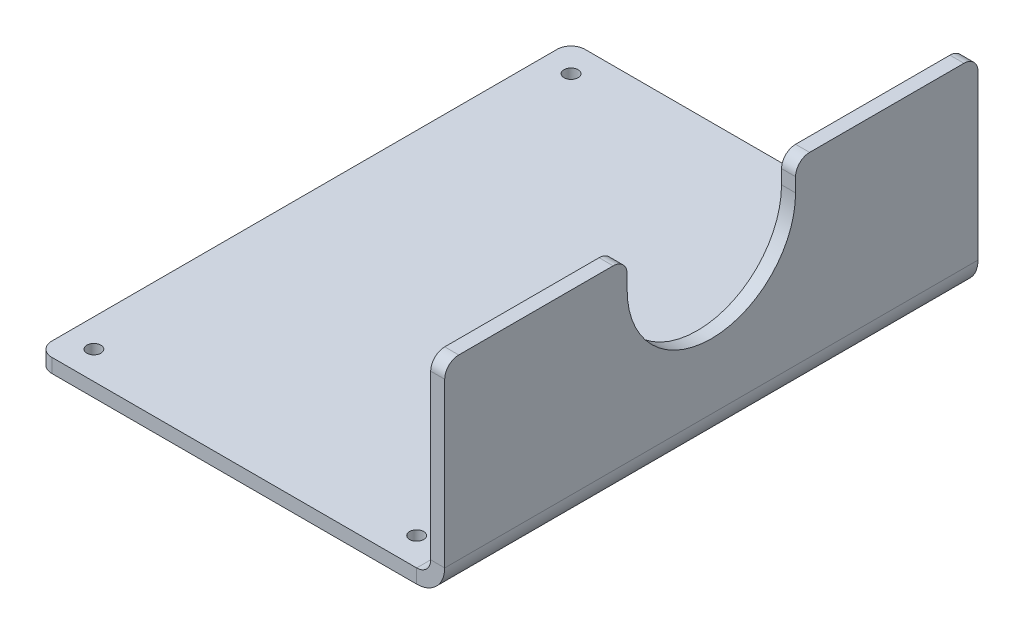
from build123d import *

# Parameters (mm, degrees)
SKETCH1_W              = 133.35
SKETCH1_H              = 120.65
BOSS_EXTRUDE1_DEPTH    = 3.175
SKETCHED_START         = -120.65
SKETCHED_BEND1_DEPTH   = 120.65
SKETCHED_BEND1_2_DEPTH = 120.65
CUT_EXTRUDE1_DEPTH     = 157.911861269
SKETCH9_R              = 1.5875
CUT_EXTRUDE2_DEPTH     = 158.831464015
FILLET1_R              = 3.175


# Read off the part's stored shape, not the designer's step: Sketched Bend1
with BuildPart() as part:
    # Sketch1 → Boss-Extrude1 (new body)
    with BuildSketch(Plane(origin=(0, 0, 0), x_dir=(1, 0, 0), z_dir=(0, 1, 0))):
        with Locations((66.675, 60.325)):
            Rectangle(SKETCH1_W, SKETCH1_H)
    extrude(amount=BOSS_EXTRUDE1_DEPTH)

    # Sketched Bend1 outline → Sketched Bend1 (cut)
    with BuildSketch(Plane.XY.offset(SKETCHED_START)):
        with BuildLine():
            Line((133.35, 3.175), (91.224261315, 3.175))
            ThreePointArc((91.224261315, 3.175), (88.900000001, 0.850738686), (85.725, 0))
            Line((85.725, 0), (133.35, 0))
            Line((133.35, 0), (133.35, 3.175))
        make_face()
    extrude(amount=SKETCHED_BEND1_DEPTH, mode=Mode.SUBTRACT)

    # Sketched Bend1 2 outline → Sketched Bend1 2 (add)
    with BuildSketch(Plane.XY.offset(SKETCHED_START)):
        with BuildLine():
            Line((88.9, 46.494082494), (88.9, 6.35))
            ThreePointArc((88.9, 6.35), (87.97006403, 4.10493597), (85.725, 3.175))
            Line((85.725, 3.175), (91.224261315, 3.175))
            ThreePointArc((91.224261315, 3.175), (91.858628997, 4.706499064), (92.075, 6.35))
            Line((92.075, 6.35), (92.075, 46.494082494))
            Line((92.075, 46.494082494), (88.9, 46.494082494))
        make_face()
    extrude(amount=SKETCHED_BEND1_2_DEPTH)

    # Sketch7 → Cut-Extrude1 (cut, through all)
    with BuildSketch(Plane.ZY.offset(-88.9)):
        with BuildLine():
            Line((-79.375, 46.494082494), (-79.375, 40.144082494))
            ThreePointArc((-79.375, 40.144082494), (-60.325, 21.094082494), (-41.275, 40.144082494))
            Line((-41.275, 40.144082494), (-41.275, 46.494082494))
            Line((-41.275, 46.494082494), (-79.375, 46.494082494))
        make_face()
    extrude(amount=-CUT_EXTRUDE1_DEPTH, mode=Mode.SUBTRACT)

    # Sketch9 → Cut-Extrude2 (cut, through all)
    with BuildSketch(Plane(origin=(0, 3.175, 0), x_dir=(1, 0, 0), z_dir=(0, 1, 0))):
        with Locations(Location((6.35, 114.3, 0), (0, 0, 270))):
            Circle(SKETCH9_R)
        with Locations(Location((79.375, 114.3, 0), (0, 0, 270))):
            Circle(SKETCH9_R)
        with Locations(Location((6.35, 6.35, 0), (0, 0, 270))):
            Circle(SKETCH9_R)
        with Locations(Location((79.375, 6.35, 0), (0, 0, 270))):
            Circle(SKETCH9_R)
    extrude(amount=-CUT_EXTRUDE2_DEPTH, mode=Mode.SUBTRACT)

    # Fillet1
    fillet1_edges = [part.edges().sort_by_distance(p)[0] for p in [
        (0, 1.5875, 0),
        (0, 1.5875, -120.65),
        (90.4875, 46.494082494, -79.375),
        (90.4875, 46.494082494, -41.275),
        (90.4875, 46.494082494, -120.65),
        (90.4875, 46.494082494, 0),
    ]]
    fillet(fillet1_edges, radius=FILLET1_R)


solid = part.part
